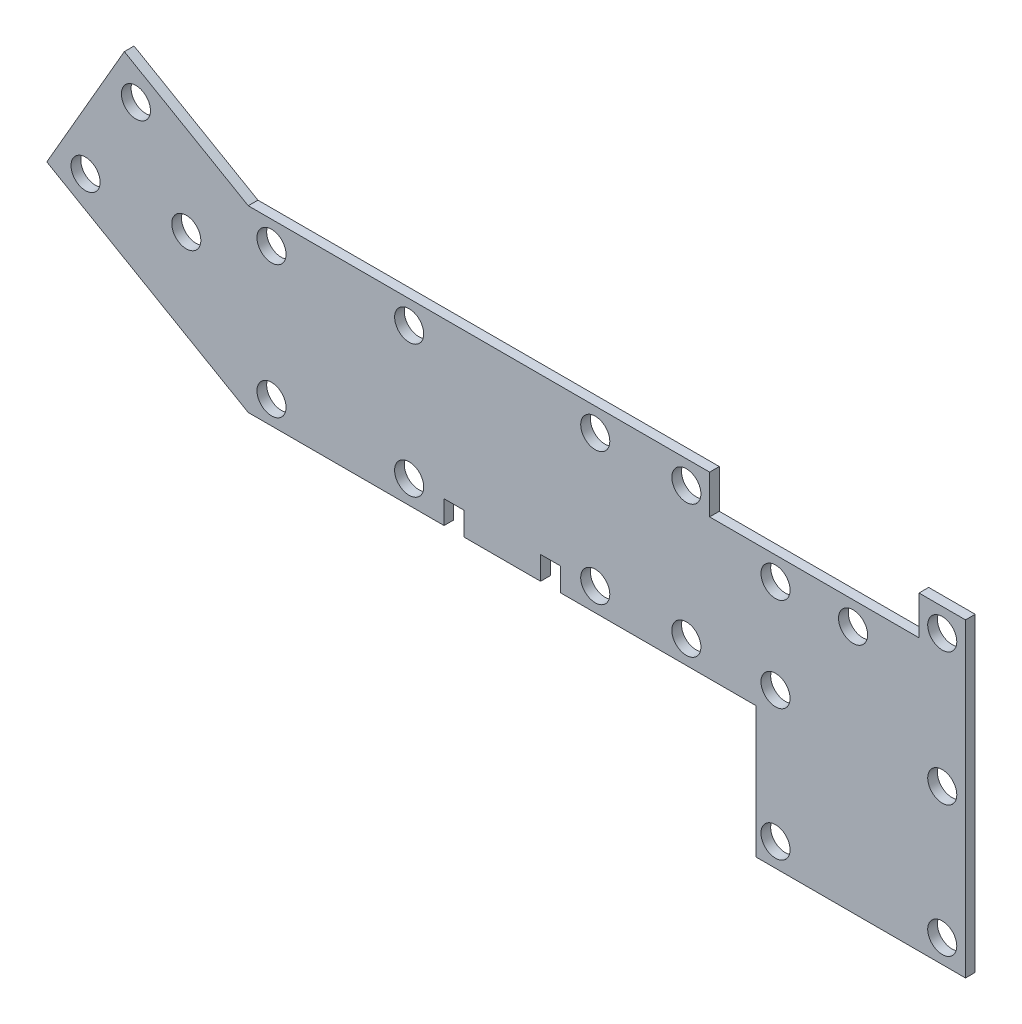
from build123d import *

# Parameters (mm, degrees)
SKETCH1_R           = 4.7625
BOSS_EXTRUDE1_DEPTH = 3.175


with BuildPart() as part:
    # Sketch1 → Boss-Extrude1 (new body)
    with BuildSketch(Plane.XY):
        Polygon((113.03, 0), (0, 0), (-40.591135768, 23.435303163), (-65.991135768, -20.55878735), (0, -58.65878735), (64.135, -58.65878735), (64.135, -51.03878735), (70.612, -51.03878735), (70.612, -58.65878735), (95.758, -58.65878735), (95.758, -51.03878735), (102.235, -51.03878735), (102.235, -58.65878735), (166.37, -58.65878735), (166.37, -101.6), (234.95, -101.6), (234.95, 0), (219.71, 0), (219.71, -12.7), (151.13, -12.7), (151.13, 0), align=None)
        with Locations((7.62, -51.03878735)):
            Circle(SKETCH1_R, mode=Mode.SUBTRACT)
        with Locations((52.705, -51.03878735)):
            Circle(SKETCH1_R, mode=Mode.SUBTRACT)
        with Locations((172.72, -93.98)):
            Circle(SKETCH1_R, mode=Mode.SUBTRACT)
        with Locations((227.33, -93.98)):
            Circle(SKETCH1_R, mode=Mode.SUBTRACT)
        with Locations((113.665, -51.03878735)):
            Circle(SKETCH1_R, mode=Mode.SUBTRACT)
        with Locations((143.51, -51.03878735)):
            Circle(SKETCH1_R, mode=Mode.SUBTRACT)
        with Locations((172.72, -51.03878735)):
            Circle(SKETCH1_R, mode=Mode.SUBTRACT)
        with Locations((227.33, -51.03878735)):
            Circle(SKETCH1_R, mode=Mode.SUBTRACT)
        with Locations((-53.291135768, -17.611742094)):
            Circle(SKETCH1_R, mode=Mode.SUBTRACT)
        with Locations((-20.295567884, -17.611742094)):
            Circle(SKETCH1_R, mode=Mode.SUBTRACT)
        with Locations((7.62, -7.62)):
            Circle(SKETCH1_R, mode=Mode.SUBTRACT)
        with Locations((-36.793351826, 10.963257906)):
            Circle(SKETCH1_R, mode=Mode.SUBTRACT)
        with Locations((52.705, -7.62)):
            Circle(SKETCH1_R, mode=Mode.SUBTRACT)
        with Locations((172.72, -20.32)):
            Circle(SKETCH1_R, mode=Mode.SUBTRACT)
        with Locations((198.12, -20.32)):
            Circle(SKETCH1_R, mode=Mode.SUBTRACT)
        with Locations((113.665, -7.62)):
            Circle(SKETCH1_R, mode=Mode.SUBTRACT)
        with Locations((143.51, -7.62)):
            Circle(SKETCH1_R, mode=Mode.SUBTRACT)
        with Locations((227.33, -7.62)):
            Circle(SKETCH1_R, mode=Mode.SUBTRACT)
    extrude(amount=BOSS_EXTRUDE1_DEPTH)


solid = part.part
